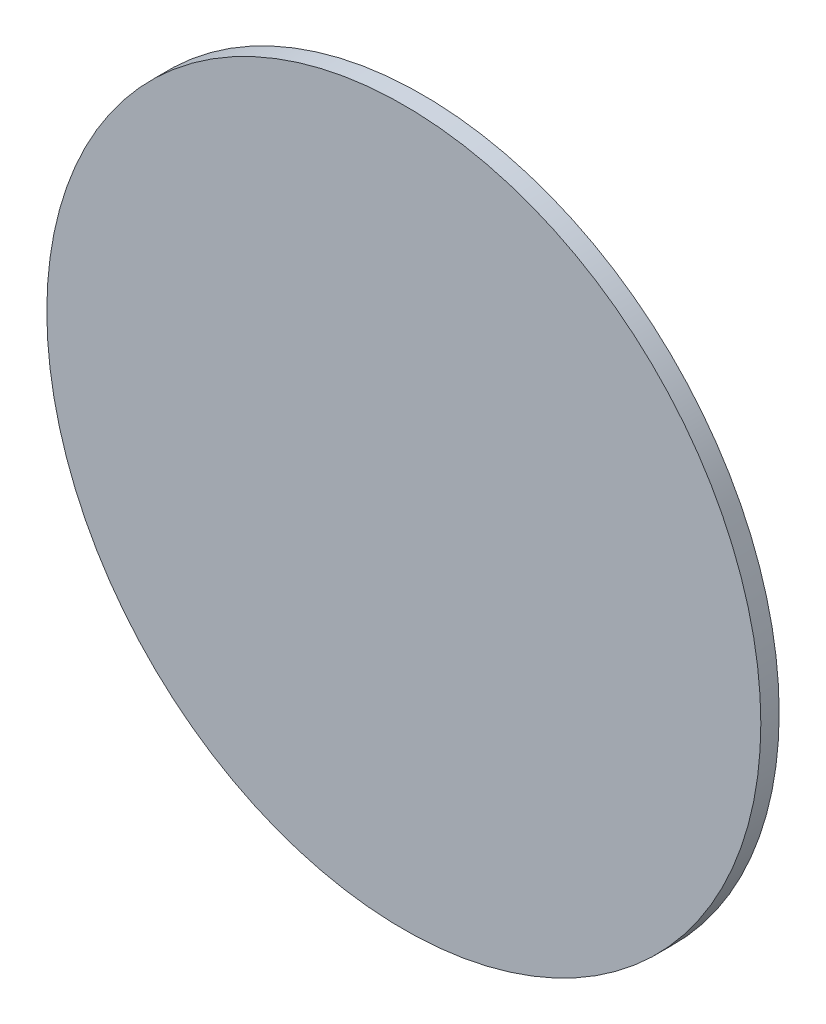
from build123d import *

# Parameters (mm, degrees)
SKETCH1_R          = 19.458391291
BASE_FLANGE1_DEPTH = 1


# Sheet-metal steps are written as plain solids
with BuildPart() as part:
    # Sketch1 → Base-Flange1 (new body)
    with BuildSketch(Plane.XY):
        Circle(SKETCH1_R)
    extrude(amount=-BASE_FLANGE1_DEPTH)


solid = part.part
